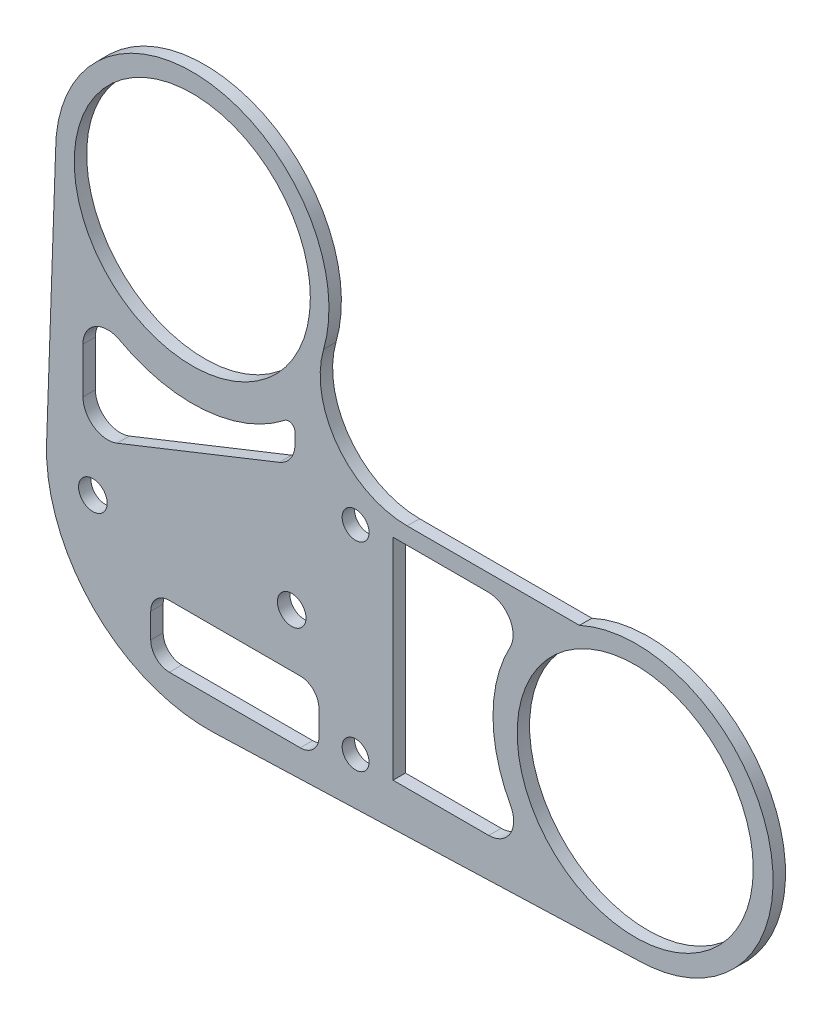
from build123d import *

# Parameters (mm, degrees)
SKETCH_3_R          = 9.5
EXTRUDE_1_DEPTH     = 1
EXTRUDE_START       = -1
EXTRUDE_2_DEPTH     = 1
FILLET_2_R          = 13
SKETCH_5_R          = 1.15
CUT_EXTRUDE_1_DEPTH = 58.922235489
SKETCH_6_R          = 9.5
CUT_EXTRUDE_2_DEPTH = 58.922235489
FILLET_3_R          = 8
FILLET_4_R          = 7
SKETCH_7_R          = 1.08334678
CUT_EXTRUDE_4_DEPTH = 10
CUT_EXTRUDE_5_DEPTH = 10


with BuildPart() as part:
    # 草图3 → 凸台-拉伸1 (new body)
    with BuildSketch(Plane.XY):
        with BuildLine():
            Line((-11, 0), (-11, -33))
            Line((-11, -33), (35.74, -33))
            ThreePointArc((35.74, -33), (46.48709263, -19.65479212), (31.157424305, -12))
            Line((31.157424305, -12), (9, -12))
            Line((9, -12), (9, -6.32455532))
            ThreePointArc((9, -6.32455532), (3.31662479, 10.488088482), (-11, 0))
        make_face()
        Circle(SKETCH_3_R, mode=Mode.SUBTRACT)
        with Locations((35.74, -22)):
            Circle(SKETCH_3_R, mode=Mode.SUBTRACT)
    extrude(amount=EXTRUDE_1_DEPTH)

    # 草图4 → 凸台-拉伸2 (add)
    with BuildSketch(Plane.XY.offset(1).offset(EXTRUDE_START)):
        with BuildLine():
            Line((35.74, -33), (-12.210859555, -34.674480913))
            Line((-12.210859555, -34.674480913), (-11, 0))
            ThreePointArc((-11, 0), (3.31662479, 10.488088482), (9, -6.32455532))
            Line((9, -6.32455532), (9, -12))
            Line((9, -12), (31.157424305, -12))
            ThreePointArc((31.157424305, -12), (46.48709263, -19.65479212), (35.74, -33))
        make_face()
    extrude(amount=EXTRUDE_2_DEPTH)

    # 圆角2
    fillet_2_edges = [part.edges().sort_by_distance(p)[0] for p in [
        (-12.210859555, -34.674480913, 0.5),
    ]]
    fillet(fillet_2_edges, radius=FILLET_2_R)

    # 草图5 → 切除-拉伸1 (cut, through all)
    with BuildSketch(Plane.XY.offset(1)):
        with Locations((-8, -22.5)):
            Circle(SKETCH_5_R)
        with Locations((8, -22.5)):
            Circle(SKETCH_5_R)
    extrude(amount=-CUT_EXTRUDE_1_DEPTH, mode=Mode.SUBTRACT)

    # 草图6 → 切除-拉伸2 (cut, through all)
    with BuildSketch(Plane.XY.offset(1)):
        Circle(SKETCH_6_R)
        with Locations((35.642814002, -22)):
            Circle(SKETCH_6_R)
    extrude(amount=-CUT_EXTRUDE_2_DEPTH, mode=Mode.SUBTRACT)

    # 圆角3
    # the kernel refuses this fillet: 8 mm, written as the material it adds along each edge
    with BuildSketch(Plane(origin=(9, -12, 0), x_dir=(0, 1, 0), z_dir=(0, 0, 1))) as fillet_3_piece_1:
        with BuildLine():
            CenterArc((8, -7.654831322), FILLET_3_R, 106.89204914, 73.10795086)
            Line((0, -7.654831322), (-0.16, -7.654831322))
            Line((-0.16, -7.654831322), (-0.16, 0))
            Line((-0.16, 0), (0, 0.16))
            ThreePointArc((0, 0.16), (2.83772234, 0.16), (5.628953573, 0.153096626))
            Line((5.628953573, 0.153096626), (5.67544468, 0))
        make_face()
    extrude(amount=1)

    # 圆角4
    fillet_4_edges = [part.edges().sort_by_distance(p)[0] for p in [
        (9, -6.32455532, 0.5),
    ]]
    fillet(fillet_4_edges, radius=FILLET_4_R)

    # 草图7 → 切除-拉伸4 (cut)
    with BuildSketch(Plane.XY.offset(1)):
        with Locations((13.142814002, -14)):
            Circle(SKETCH_7_R)
        with Locations((13.142814002, -30)):
            Circle(SKETCH_7_R)
    extrude(amount=-CUT_EXTRUDE_4_DEPTH, mode=Mode.SUBTRACT)

    # 草图8 → 切除-拉伸5 (cut)
    with BuildSketch(Plane.XY.offset(1)):
        with BuildLine():
            Line((16.157202734, -30.291096898), (16.157202734, -13.355657228))
            Line((16.157202734, -13.355657228), (23.81874567, -13.355657228))
            ThreePointArc((23.81874567, -13.355657228), (25.535376674, -14.32941262), (25.580428982, -16.302479233))
            ThreePointArc((25.580428982, -16.302479233), (24.200275644, -21.822246327), (25.614952461, -27.333266333))
            ThreePointArc((25.614952461, -27.333266333), (25.579064672, -29.3119639), (23.859230214, -30.291096898))
            Line((23.859230214, -30.291096898), (16.157202734, -30.291096898))
        make_face()
        with BuildLine():
            Line((-1.844212644, -26.7628803), (8.691309214, -26.7628803))
            ThreePointArc((8.691309214, -26.7628803), (9.751969386, -27.202220128), (10.191309214, -28.2628803))
            Line((10.191309214, -28.2628803), (10.191309214, -30.26653293))
            ThreePointArc((10.191309214, -30.26653293), (9.751969386, -31.327193102), (8.691309214, -31.76653293))
            Line((8.691309214, -31.76653293), (-1.844212644, -31.76653293))
            ThreePointArc((-1.844212644, -31.76653293), (-2.904872816, -31.327193102), (-3.344212644, -30.26653293))
            Line((-3.344212644, -30.26653293), (-3.344212644, -28.2628803))
            ThreePointArc((-3.344212644, -28.2628803), (-2.904872816, -27.202220128), (-1.844212644, -26.7628803))
        make_face()
        with BuildLine():
            Line((-8.796911022, -16.052867786), (-8.796911022, -12.380312846))
            ThreePointArc((-8.796911022, -12.380312846), (-7.815486406, -10.659120182), (-5.834406834, -10.627148368))
            ThreePointArc((-5.834406834, -10.627148368), (0.968228408, -12.084664633), (7.452020697, -9.562634212))
            ThreePointArc((7.452020697, -9.562634212), (7.978826228, -9.507761331), (8.259361329, -9.957022011))
            Line((8.259361329, -9.957022011), (8.259361329, -10.859557769))
            ThreePointArc((8.259361329, -10.859557769), (7.914413338, -11.982412545), (6.99855848, -12.717940822))
            Line((6.99855848, -12.717940822), (-6.057713871, -17.911250839))
            ThreePointArc((-6.057713871, -17.911250839), (-7.919765799, -17.707919794), (-8.796911022, -16.052867786))
        make_face()
    extrude(amount=-CUT_EXTRUDE_5_DEPTH, mode=Mode.SUBTRACT)


solid = part.part
